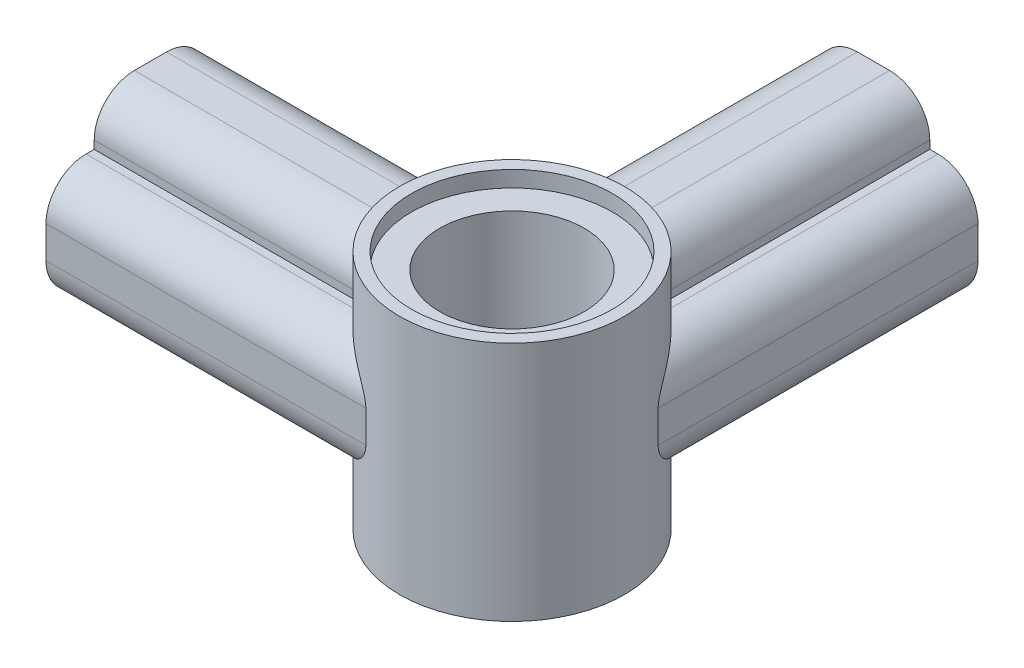
from build123d import *

# Parameters (mm, degrees)
EXTRUDE1_DEPTH     = 11.43
CIRPATTERN1_COUNT  = 2
CIRPATTERN1_ANGLE  = 90
SKETCH6_R          = 3.556
EXTRUDE2_DEPTH     = 3.81
SKETCH7_R          = 3.175
CUT_EXTRUDE2_DEPTH = 0.508
SKETCH8_R          = 2.286
CUT_EXTRUDE3_DEPTH = 21.144618306


with BuildPart() as part:
    # Sketch1 → Extrude1 (new body)
    with BuildSketch(Plane.XY):
        with BuildLine():
            Line((2.032, 1.778), (1.778, 1.778))
            Line((1.778, 1.778), (1.778, 2.032))
            ThreePointArc((1.778, 2.032), (1.406025612, 2.930025612), (0.508, 3.302))
            Line((0.508, 3.302), (-0.508, 3.302))
            ThreePointArc((-0.508, 3.302), (-1.406025612, 2.930025612), (-1.778, 2.032))
            Line((-1.778, 2.032), (-1.778, 1.778))
            Line((-1.778, 1.778), (-2.032, 1.778))
            ThreePointArc((-2.032, 1.778), (-2.930025612, 1.406025612), (-3.302, 0.508))
            Line((-3.302, 0.508), (-3.302, -0.508))
            ThreePointArc((-3.302, -0.508), (-2.930025612, -1.406025612), (-2.032, -1.778))
            Line((-2.032, -1.778), (-1.778, -1.778))
            Line((-1.778, -1.778), (-1.778, -2.032))
            ThreePointArc((-1.778, -2.032), (-1.406025612, -2.930025612), (-0.508, -3.302))
            Line((-0.508, -3.302), (0.508, -3.302))
            ThreePointArc((0.508, -3.302), (1.406025612, -2.930025612), (1.778, -2.032))
            Line((1.778, -2.032), (1.778, -1.778))
            Line((1.778, -1.778), (2.032, -1.778))
            ThreePointArc((2.032, -1.778), (2.930025612, -1.406025612), (3.302, -0.508))
            Line((3.302, -0.508), (3.302, 0.508))
            ThreePointArc((3.302, 0.508), (2.930025612, 1.406025612), (2.032, 1.778))
        make_face()
        with BuildLine():
            Line((-0.762, 2.032), (-0.762, 1.016))
            ThreePointArc((-0.762, 1.016), (-0.836394878, 0.836394878), (-1.016, 0.762))
            Line((-1.016, 0.762), (-2.032, 0.762))
            ThreePointArc((-2.032, 0.762), (-2.211605122, 0.687605122), (-2.286, 0.508))
            Line((-2.286, 0.508), (-2.286, -0.508))
            ThreePointArc((-2.286, -0.508), (-2.211605122, -0.687605122), (-2.032, -0.762))
            Line((-2.032, -0.762), (-1.016, -0.762))
            ThreePointArc((-1.016, -0.762), (-0.836394878, -0.836394878), (-0.762, -1.016))
            Line((-0.762, -1.016), (-0.762, -2.032))
            ThreePointArc((-0.762, -2.032), (-0.687605122, -2.211605122), (-0.508, -2.286))
            Line((-0.508, -2.286), (0.508, -2.286))
            ThreePointArc((0.508, -2.286), (0.687605122, -2.211605122), (0.762, -2.032))
            Line((0.762, -2.032), (0.762, -1.016))
            ThreePointArc((0.762, -1.016), (0.836394878, -0.836394878), (1.016, -0.762))
            Line((1.016, -0.762), (2.032, -0.762))
            ThreePointArc((2.032, -0.762), (2.211605122, -0.687605122), (2.286, -0.508))
            Line((2.286, -0.508), (2.286, 0.508))
            ThreePointArc((2.286, 0.508), (2.211605122, 0.687605122), (2.032, 0.762))
            Line((2.032, 0.762), (1.016, 0.762))
            ThreePointArc((1.016, 0.762), (0.836394878, 0.836394878), (0.762, 1.016))
            Line((0.762, 1.016), (0.762, 2.032))
            ThreePointArc((0.762, 2.032), (0.687605122, 2.211605122), (0.508, 2.286))
            Line((0.508, 2.286), (-0.508, 2.286))
            ThreePointArc((-0.508, 2.286), (-0.687605122, 2.211605122), (-0.762, 2.032))
        make_face(mode=Mode.SUBTRACT)
    extrude1 = extrude(amount=EXTRUDE1_DEPTH)

    # CirPattern1: Extrude1 ×2 about axis
    cirpattern1_axis = Axis((0, -5.901087393, 11.43), (0, 1, 0))
    for i in range(1, CIRPATTERN1_COUNT):
        add(extrude1.rotate(cirpattern1_axis, i * CIRPATTERN1_ANGLE / (CIRPATTERN1_COUNT - 1)))

    # Sketch6 → Extrude2 (add, symmetric)
    with BuildSketch(Plane(origin=(0, 0, 0), x_dir=(1, 0, 0), z_dir=(0, 1, 0))):
        with Locations((0, -11.43)):
            Circle(SKETCH6_R)
    extrude(amount=EXTRUDE2_DEPTH, both=True)

    # Sketch7 → Cut-Extrude2 (cut)
    with BuildSketch(Plane(origin=(0, 3.81, 0), x_dir=(1, 0, 0), z_dir=(0, 1, 0))):
        with Locations((0, -11.43)):
            Circle(SKETCH7_R)
    cut_extrude2 = extrude(amount=-CUT_EXTRUDE2_DEPTH, mode=Mode.SUBTRACT)

    # Mirror1: Cut-Extrude2 across plane
    add(cut_extrude2.mirror(Plane.ZX), mode=Mode.SUBTRACT)

    # Sketch8 → Cut-Extrude3 (cut, through all)
    with BuildSketch(Plane(origin=(0, 3.302, 0), x_dir=(1, 0, 0), z_dir=(0, 1, 0))):
        with Locations((0, -11.43)):
            Circle(SKETCH8_R)
    extrude(amount=-CUT_EXTRUDE3_DEPTH, mode=Mode.SUBTRACT)


solid = part.part
